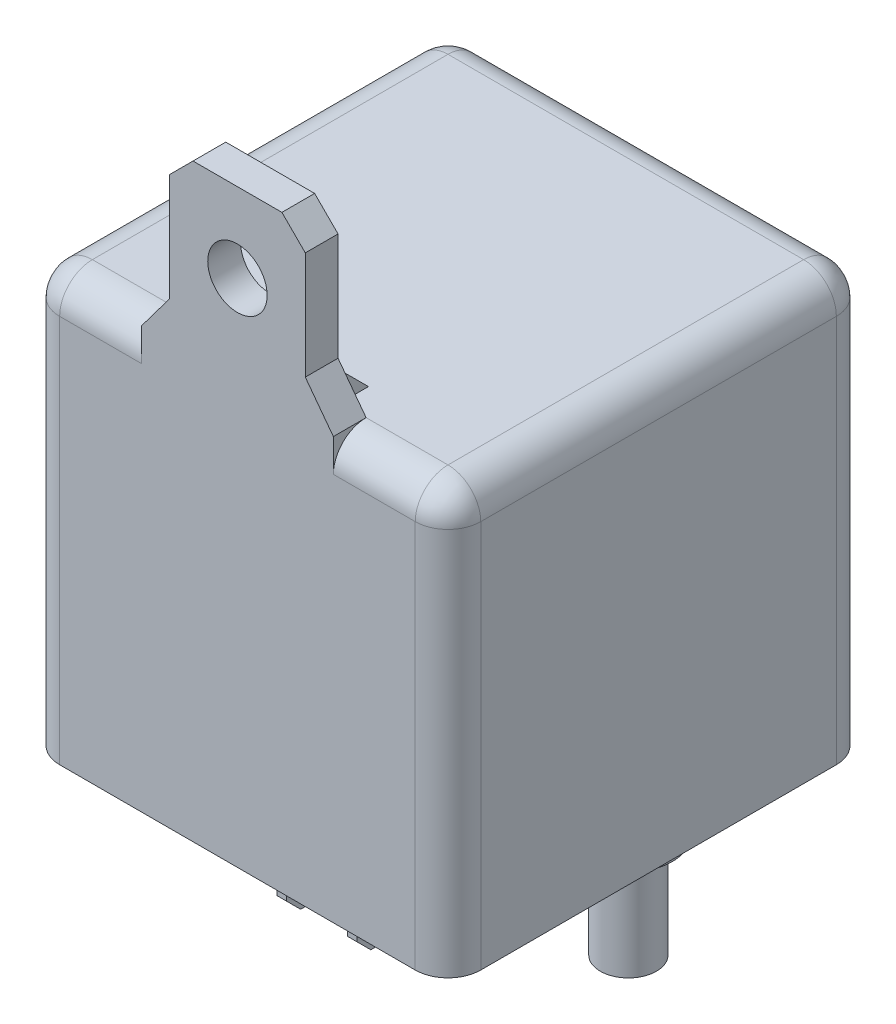
from build123d import *

# Parameters (mm, degrees)
SKETCH_1_W                 = 45
SKETCH_1_H                 = 45
EXTRUDE_1_DEPTH            = 45
FILLET_1_R                 = 3.5
EXTRUDE_2_DEPTH            = 18
EXTRUDE_2_DEPTH_BACK       = 5
SKETCH_2_W                 = 14.5
SKETCH_2_H                 = 3.5
SKETCH_4_W                 = 3
SKETCH_4_H                 = 3.5
EXTRUDE_3_DEPTH            = 3.5
CHAMFER_1_SIZE             = 2.5
SKETCH_5_R                 = 3.175
CUT_EXTRUDE_1_DEPTH        = 3.5
SKETCH_6_W                 = 2
SKETCH_6_H                 = 3
EXTRUDE_4_DEPTH            = 3
CHAMFER_2_SIZE             = 3
CHAMFER_2_OF_MIRROR_2_SIZE = 3
CUT_EXTRUDE_2_DEPTH        = 1.5
CHAMFER_3_SIZE             = 0.5
SKETCH_8_W                 = 1
SKETCH_8_H                 = 6.35
EXTRUDE_5_DEPTH            = 10.5
EXTRUDE_START              = -2
EXTRUDE_6_DEPTH            = 3.5
SKETCH_10_R                = 4.7
EXTRUDE_7_DEPTH            = 2
SKETCH_11_R                = 3
EXTRUDE_8_DEPTH            = 11
CHAMFER_4_SIZE             = 1.5


with BuildPart() as part:
    # ｽｹｯﾁ1 → ﾎﾞｽ - 押し出し1 (new body)
    with BuildSketch(Plane(origin=(0, 0, 0), x_dir=(1, 0, 0), z_dir=(0, 1, 0))):
        Rectangle(SKETCH_1_W, SKETCH_1_H)
    extrude(amount=EXTRUDE_1_DEPTH)

    # ﾌｨﾚｯﾄ1
    fillet_1_edges = [part.edges().sort_by_distance(p)[0] for p in [
        (-22.5, 45, 0),
        (0, 45, 22.5),
        (22.5, 45, 0),
        (22.5, 22.5, 22.5),
        (-22.5, 22.5, 22.5),
        (-22.5, 22.5, -22.5),
        (22.5, 22.5, -22.5),
        (0, 45, -22.5),
    ]]
    fillet(fillet_1_edges, radius=FILLET_1_R)

    # ｽｹｯﾁ2 → ﾎﾞｽ - 押し出し2 (add, two sides: drawn at the far end of the back side and taken through both)
    with BuildSketch(Plane(origin=(0, 45, 0), x_dir=(1, 0, 0), z_dir=(0, 1, 0)).offset(-EXTRUDE_2_DEPTH_BACK)):
        with Locations((0, -20.75)):
            Rectangle(SKETCH_2_W, SKETCH_2_H)
    extrude(amount=EXTRUDE_2_DEPTH + EXTRUDE_2_DEPTH_BACK)

    # ｽｹｯﾁ4 → ﾎﾞｽ - 押し出し3 (add)
    with BuildSketch(Plane.XY.offset(22.5)):
        Polygon((-7.25, 45), (-7.25, 49), (-10.25, 45), align=None)
        with Locations((-8.75, 43.25)):
            Rectangle(SKETCH_4_W, SKETCH_4_H)
    extrude_3 = extrude(amount=-EXTRUDE_3_DEPTH)

    # ﾐﾗｰ1: ﾎﾞｽ - 押し出し3 across plane
    add(extrude_3.mirror(Plane(origin=(0, 0, 0), x_dir=(0, 0, 1), z_dir=(1, 0, 0))))

    # 面取り1
    chamfer_1_edges = [part.edges().sort_by_distance(p)[0] for p in [
        (-7.25, 63, 20.75),
        (7.25, 63, 20.75),
    ]]
    chamfer(chamfer_1_edges, length=CHAMFER_1_SIZE)

    # ｽｹｯﾁ5 → ｶｯﾄ - 押し出し1 (cut)
    with BuildSketch(Plane(origin=(0, 0, 19), x_dir=(-1, 0, 0), z_dir=(0, 0, -1))):
        with Locations((0, 54.525)):
            Circle(SKETCH_5_R)
    extrude(amount=-CUT_EXTRUDE_1_DEPTH, mode=Mode.SUBTRACT)

    # ｽｹｯﾁ6 → ﾎﾞｽ - 押し出し4 (add)
    with BuildSketch(Plane(origin=(0, 0, 19), x_dir=(-1, 0, 0), z_dir=(0, 0, -1))):
        with Locations((-6.5, 46.5)):
            Rectangle(SKETCH_6_W, SKETCH_6_H)
    extrude_4 = extrude(amount=EXTRUDE_4_DEPTH)

    # 面取り2
    chamfer_2_edges = [part.edges().sort_by_distance(p)[0] for p in [
        (6.5, 48, 16),
    ]]
    chamfer(chamfer_2_edges, length=CHAMFER_2_SIZE - 0.0001)  # a hair under: the kernel refuses the full size

    # ﾐﾗｰ2: ﾎﾞｽ - 押し出し4 across plane
    add(extrude_4.mirror(Plane(origin=(0, 0, 0), x_dir=(0, 0, 1), z_dir=(1, 0, 0))))

    # 面取り2 of ﾐﾗｰ2
    chamfer_2_of_mirror_2_edges = [part.edges().sort_by_distance(p)[0] for p in [
        (-6.5, 48, 16),
    ]]
    chamfer(chamfer_2_of_mirror_2_edges, length=CHAMFER_2_OF_MIRROR_2_SIZE - 0.0001)  # a hair under: the kernel refuses the full size

    # ｽｹｯﾁ7 → ｶｯﾄ - 押し出し2 (cut)
    with BuildSketch(Plane.XZ):
        with BuildLine():
            Line((21, -19), (21, 19))
            ThreePointArc((21, 19), (20.414213562, 20.414213562), (19, 21))
            Line((19, 21), (-19, 21))
            ThreePointArc((-19, 21), (-20.414213562, 20.414213562), (-21, 19))
            Line((-21, 19), (-21, -19))
            ThreePointArc((-21, -19), (-20.414213562, -20.414213562), (-19, -21))
            Line((-19, -21), (19, -21))
            ThreePointArc((19, -21), (20.414213562, -20.414213562), (21, -19))
        make_face()
        with BuildLine():
            ThreePointArc((20, 19), (19.707106781, 19.707106781), (19, 20))
            Line((19, 20), (-19, 20))
            ThreePointArc((-19, 20), (-19.707106781, 19.707106781), (-20, 19))
            Line((-20, 19), (-20, -19))
            ThreePointArc((-20, -19), (-19.707106781, -19.707106781), (-19, -20))
            Line((-19, -20), (19, -20))
            ThreePointArc((19, -20), (19.707106781, -19.707106781), (20, -19))
            Line((20, -19), (20, 19))
        make_face(mode=Mode.SUBTRACT)
    extrude(amount=-CUT_EXTRUDE_2_DEPTH, mode=Mode.SUBTRACT)

    # 面取り3
    chamfer_3_edges = [part.edges().sort_by_distance(p)[0] for p in [
        (21, 0, 0),
        (20.414213562, 0, 20.414213562),
        (0, 0, 21),
        (-20.414213562, 0, 20.414213562),
        (-21, 0, 0),
        (-20.414213562, 0, -20.414213562),
        (0, 0, -21),
        (20.414213562, 0, -20.414213562),
    ]]
    chamfer(chamfer_3_edges, length=CHAMFER_3_SIZE)

    # ｽｹｯﾁ8 → ﾎﾞｽ - 押し出し5 (add)
    with BuildSketch(Plane.XZ):
        with Locations((3.75, 10.825)):
            Rectangle(SKETCH_8_W, SKETCH_8_H)
    extrude_5 = extrude(amount=EXTRUDE_5_DEPTH)

    # ｽｹｯﾁ9 → ﾎﾞｽ - 押し出し6 (add)
    with BuildSketch(Plane.XZ.offset(EXTRUDE_START)):
        with BuildLine():
            ThreePointArc((20, -7.172915762), (20.373670062, -5.999744871), (20.5, -4.775))
            ThreePointArc((20.5, -4.775), (20.373670062, -3.550255129), (20, -2.377084238))
            Line((20, -2.377084238), (20, -7.172915762))
        make_face()
        with BuildLine():
            Line((20, -7.172915762), (20, -2.377084238))
            ThreePointArc((20, -2.377084238), (8.5, -4.775), (20, -7.172915762))
        make_face()
    extrude_6 = extrude(amount=EXTRUDE_6_DEPTH)

    # ｽｹｯﾁ10 → ﾎﾞｽ - 押し出し7 (add)
    with BuildSketch(Plane.XZ.offset(1.5)):
        with Locations(Location((14.5, -4.775, 0), (0, 0, 270))):
            Circle(SKETCH_10_R)
    extrude_7 = extrude(amount=EXTRUDE_7_DEPTH)

    # ｽｹｯﾁ11 → ﾎﾞｽ - 押し出し8 (add)
    with BuildSketch(Plane.XZ.offset(3.5)):
        with Locations(Location((14.5, -4.775, 0), (0, 0, 270))):
            Circle(SKETCH_11_R)
    extrude_8 = extrude(amount=EXTRUDE_8_DEPTH)

    # ﾐﾗｰ3: ﾎﾞｽ - 押し出し5, ﾎﾞｽ - 押し出し6, ﾎﾞｽ - 押し出し7, ﾎﾞｽ - 押し出し8 across plane
    add(extrude_5.mirror(Plane(origin=(0, 0, 0), x_dir=(0, 0, 1), z_dir=(1, 0, 0))))
    add(extrude_6.mirror(Plane(origin=(0, 0, 0), x_dir=(0, 0, 1), z_dir=(1, 0, 0))))
    add(extrude_7.mirror(Plane(origin=(0, 0, 0), x_dir=(0, 0, 1), z_dir=(1, 0, 0))))
    add(extrude_8.mirror(Plane(origin=(0, 0, 0), x_dir=(0, 0, 1), z_dir=(1, 0, 0))))

    # 面取り4
    chamfer_4_edges = [part.edges().sort_by_distance(p)[0] for p in [
        (3.75, -10.5, 14),
        (3.75, -10.5, 7.65),
        (-3.75, -10.5, 7.65),
        (-3.75, -10.5, 14),
    ]]
    chamfer(chamfer_4_edges, length=CHAMFER_4_SIZE)


solid = part.part
